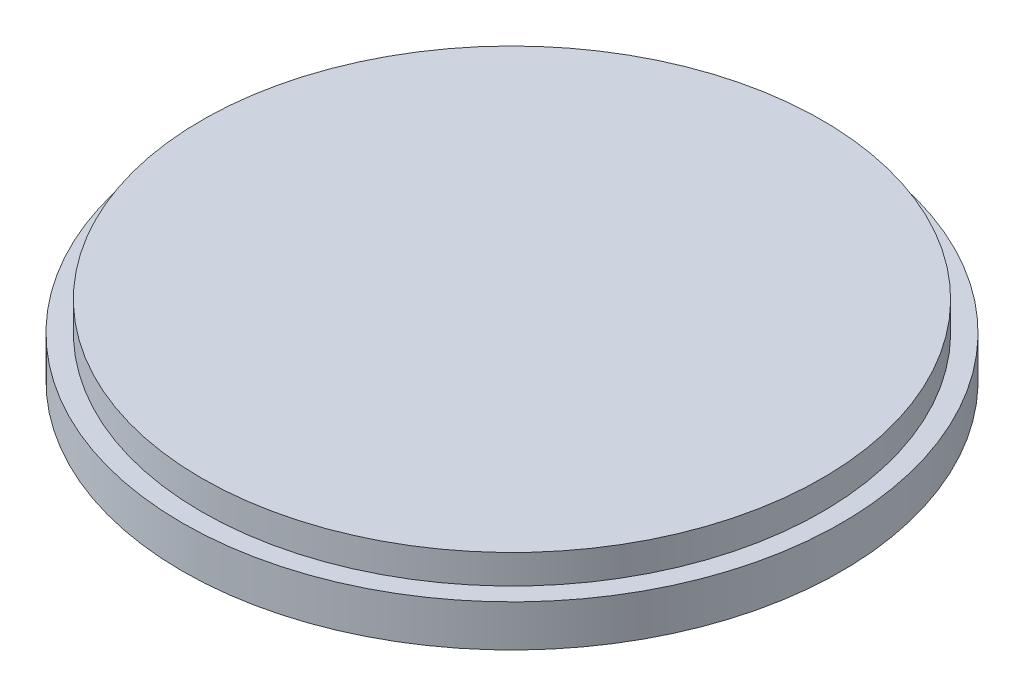
from build123d import *

# Parameters (mm, degrees)
SKETCH2_R                = 32
BOSS_EXTRUDE1_DEPTH      = 3
M3_CLEARANCE_HOLE1_D     = 3.4
M3_CLEARANCE_HOLE1_DEPTH = 4
M3_CLEARANCE_HOLE1_TIP   = 1.021463052


with BuildPart() as part:
    # Sketch1 → Revolve1 (revolve)
    with BuildSketch(Plane.XY):
        Polygon((-26.5, -7.3), (-34, -4.3), (-34, 0), (0, 0), (0, -7.3), align=None)
    revolve(axis=Axis((0, -7.3, 0), (0, 1, 0)))

    # Sketch2 → Boss-Extrude1 (add)
    with BuildSketch(Plane(origin=(0, 0, 0), x_dir=(1, 0, 0), z_dir=(0, 1, 0))):
        Circle(SKETCH2_R)
    extrude(amount=BOSS_EXTRUDE1_DEPTH)

    # M3 Clearance Hole1
    with Locations(Plane(origin=(0, -7.3, 0), x_dir=(-1, 0, 0), z_dir=(0, -1, 0))):
        with Locations((15.556349186, -15.556349186), (15.556349186, 15.556349186), (-15.556349186, 15.556349186), (-15.556349186, -15.556349186)):
            Hole(M3_CLEARANCE_HOLE1_D / 2, depth=M3_CLEARANCE_HOLE1_DEPTH)
            with Locations((0, 0, -(M3_CLEARANCE_HOLE1_DEPTH + M3_CLEARANCE_HOLE1_TIP / 2))):  # 118° drill point
                Cone(0, M3_CLEARANCE_HOLE1_D / 2, M3_CLEARANCE_HOLE1_TIP, mode=Mode.SUBTRACT)


solid = part.part
